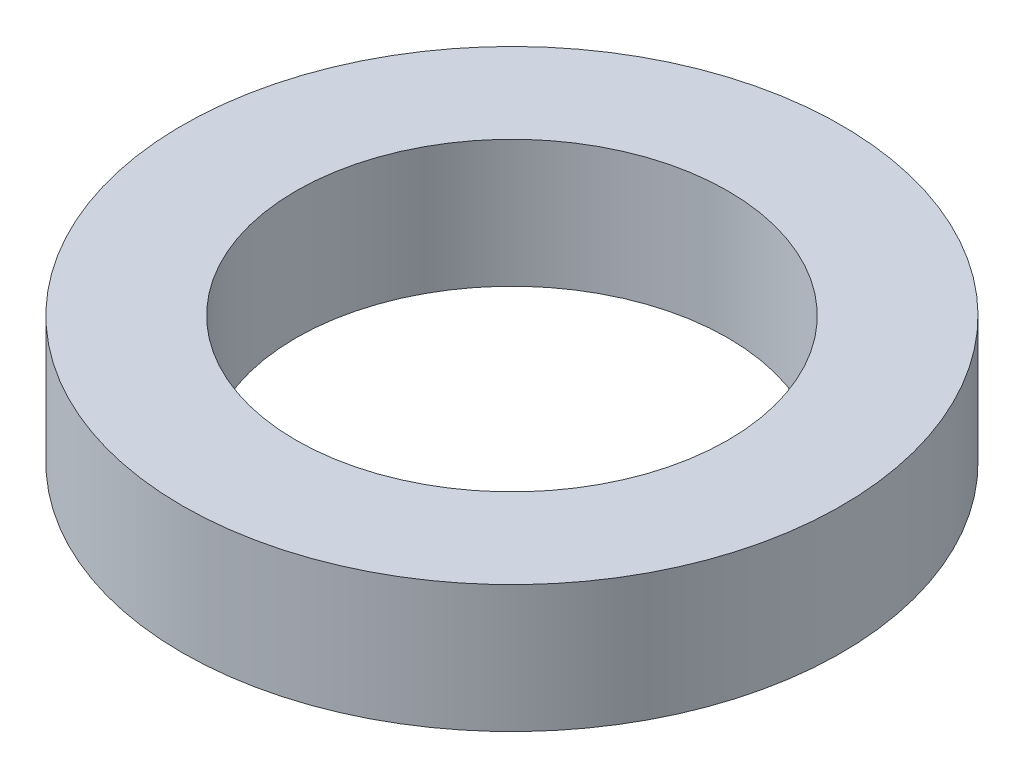
from build123d import *

# Parameters (mm, degrees)
SKETCH1_R           = 72.5
BOSS_EXTRUDE1_DEPTH = 28
SKETCH2_R           = 47.5
CUT_EXTRUDE1_DEPTH  = 107.284994237


with BuildPart() as part:
    # Sketch1 → Boss-Extrude1 (new body)
    with BuildSketch(Plane(origin=(0, 0, 0), x_dir=(1, 0, 0), z_dir=(0, 1, 0))):
        Circle(SKETCH1_R)
    extrude(amount=BOSS_EXTRUDE1_DEPTH)

    # Sketch2 → Cut-Extrude1 (cut, through all)
    with BuildSketch(Plane(origin=(0, 0, 0), x_dir=(1, 0, 0), z_dir=(0, 1, 0))):
        Circle(SKETCH2_R)
    extrude(amount=CUT_EXTRUDE1_DEPTH, mode=Mode.SUBTRACT)


solid = part.part
